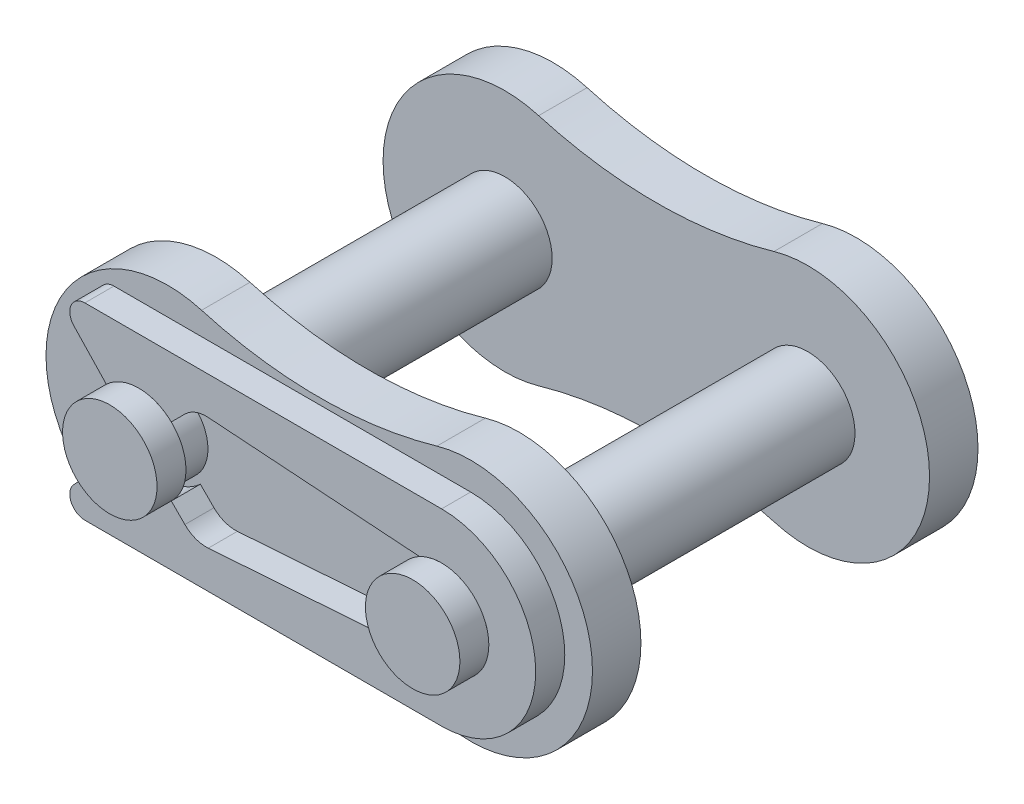
from build123d import *

# Parameters (mm, degrees)
SKETCH4_R                  = 3.9624
SKETCH4_R_2                = 2.0066
BOSS_EXTRUDE1_DEPTH        = 3.96875
SKETCH5_R                  = 1.9812
BOSS_EXTRUDE2_DEPTH        = 2.032
LPATTERN1_COUNT            = 2
LPATTERN1_PITCH            = 12.7
SKETCH7_R                  = 1.9812
BOSS_EXTRUDE3_DEPTH        = 2.032
MIRROR1_START              = 6.05155
MIRROR1_OUTLINE_R          = 1.9812
MIRROR1_DEPTH              = 2.032
BOSS_EXTRUDE4_DEPTH        = 10.5156
BOSS_EXTRUDE4_DEPTH_BACK   = 9.2964
SKETCH8_R                  = 1.9812
BOSS_EXTRUDE4_2_DEPTH      = 10.5156
BOSS_EXTRUDE4_2_DEPTH_BACK = 9.2964
BOSS_EXTRUDE5_DEPTH        = 1.2192
SKETCH12_R                 = 1.9812
SKETCH12_R_2               = 1.68402
CUT_EXTRUDE1_DEPTH         = 1.2192


# Read off the part's stored shape, not the designer's step: Mirror1
with BuildPart() as part:
    # Sketch4 → Boss-Extrude1 (new, symmetric)
    with BuildSketch(Plane.XY):
        with Locations((6.35, 0)):
            Circle(SKETCH4_R)
        with Locations((6.35, 0)):
            Circle(SKETCH4_R_2, mode=Mode.SUBTRACT)
    extrude(amount=BOSS_EXTRUDE1_DEPTH, both=True)


with BuildPart() as body_2:
    # Sketch5 → Boss-Extrude2 (new body)
    with BuildSketch(Plane.XY.offset(3.96875)):
        with BuildLine():
            ThreePointArc((-4.787931893, 5.589740462), (-12.1539, 0), (-4.787931893, -5.589740462))
            ThreePointArc((-4.787931893, -5.589740462), (0, -4.933315), (4.787931893, -5.589740462))
            ThreePointArc((4.787931893, -5.589740462), (12.1539, 0), (4.787931893, 5.589740462))
            ThreePointArc((4.787931893, 5.589740462), (0, 4.933315), (-4.787931893, 5.589740462))
        make_face()
        with Locations((-6.35, 0)):
            Circle(SKETCH5_R, mode=Mode.SUBTRACT)
        with Locations((6.35, 0)):
            Circle(SKETCH5_R, mode=Mode.SUBTRACT)
    extrude(amount=BOSS_EXTRUDE2_DEPTH)


with BuildPart() as lpattern1_1:
    # LPattern1: pattern copy
    add(part.part.moved(Location(Vector(1, 0, 0) * (1 * LPATTERN1_PITCH))))


with BuildPart() as body_4:
    # Sketch7 → Boss-Extrude3 (new body)
    with BuildSketch(Plane.XY.offset(-6.05155)):
        with BuildLine():
            ThreePointArc((7.766432158, 4.907095024), (1.242568, 0), (7.766432158, -4.907095024))
            ThreePointArc((7.766432158, -4.907095024), (12.7, -4.209302295), (17.633567842, -4.907095024))
            ThreePointArc((17.633567842, -4.907095024), (24.157432, 0), (17.633567842, 4.907095024))
            ThreePointArc((17.633567842, 4.907095024), (12.7, 4.209302295), (7.766432158, 4.907095024))
        make_face()
        with Locations((6.35, 0)):
            Circle(SKETCH7_R, mode=Mode.SUBTRACT)
        with Locations((19.05, 0)):
            Circle(SKETCH7_R, mode=Mode.SUBTRACT)
    extrude(amount=-BOSS_EXTRUDE3_DEPTH)


with BuildPart() as body_5:
    # Mirror1 outline → Mirror1 (new body)
    with BuildSketch(Plane.XY.offset(MIRROR1_START)):
        with BuildLine():
            ThreePointArc((17.633567842, -4.907095024), (24.157432, 0), (17.633567842, 4.907095024))
            ThreePointArc((17.633567842, 4.907095024), (12.7, 4.209302295), (7.766432158, 4.907095024))
            ThreePointArc((7.766432158, 4.907095024), (1.242568, 0), (7.766432158, -4.907095024))
            ThreePointArc((7.766432158, -4.907095024), (12.7, -4.209302295), (17.633567842, -4.907095024))
        make_face()
        with Locations((6.35, 0)):
            Circle(MIRROR1_OUTLINE_R, mode=Mode.SUBTRACT)
        with Locations((19.05, 0)):
            Circle(MIRROR1_OUTLINE_R, mode=Mode.SUBTRACT)
    extrude(amount=MIRROR1_DEPTH)


with BuildPart() as body_3:
    # Sketch8 → Boss-Extrude4 (new, two sides: drawn at the far end of the back side and taken through both)
    with BuildSketch(Plane.XY.offset(-BOSS_EXTRUDE4_DEPTH_BACK)):
        with Locations((6.35, 0)):
            Circle(SKETCH8_R)
    extrude(amount=BOSS_EXTRUDE4_DEPTH + BOSS_EXTRUDE4_DEPTH_BACK)


with BuildPart() as body_4_2:
    # Sketch8 → Boss-Extrude4 2 (new, two sides: drawn at the far end of the back side and taken through both)
    with BuildSketch(Plane.XY.offset(-BOSS_EXTRUDE4_2_DEPTH_BACK)):
        with Locations((19.05, 0)):
            Circle(SKETCH8_R)
    extrude(amount=BOSS_EXTRUDE4_2_DEPTH + BOSS_EXTRUDE4_2_DEPTH_BACK)


with BuildPart() as body_5_2:
    # Sketch10 → Boss-Extrude5 (new body)
    with BuildSketch(Plane.XY.offset(8.08355)):
        with BuildLine():
            Line((19.05, -3.946652), (4.091050732, -3.946652))
            ThreePointArc((4.091050732, -3.946652), (3.511202451, -3.565299839), (3.631666978, -2.881822116))
            Line((3.631666978, -2.881822116), (5.194473642, -1.225023345))
            ThreePointArc((5.194473642, -1.225023345), (6.35, -1.68402), (7.505526358, -1.225023345))
            Line((7.505526358, -1.225023345), (8.285872934, -2.005369922))
            ThreePointArc((8.285872934, -2.005369922), (8.73664223, -2.295314476), (9.267062878, -2.37222181))
            Line((9.267062878, -2.37222181), (19.167471297, -1.679917812))
            ThreePointArc((19.167471297, -1.679917812), (20.73402, 0), (19.167471297, 1.679917812))
            Line((19.167471297, 1.679917812), (9.267062878, 2.37222181))
            ThreePointArc((9.267062878, 2.37222181), (8.73664223, 2.295314476), (8.285872934, 2.005369922))
            Line((8.285872934, 2.005369922), (7.505526358, 1.225023345))
            ThreePointArc((7.505526358, 1.225023345), (6.35, 1.68402), (5.194473642, 1.225023345))
            Line((5.194473642, 1.225023345), (3.631666978, 2.881822116))
            ThreePointArc((3.631666978, 2.881822116), (3.511202451, 3.565299839), (4.091050732, 3.946652))
            Line((4.091050732, 3.946652), (19.05, 3.946652))
            ThreePointArc((19.05, 3.946652), (22.996652, 0), (19.05, -3.946652))
        make_face()
    extrude(amount=BOSS_EXTRUDE5_DEPTH)


with BuildPart() as cut_extrude1_tool:
    # Sketch12 → Cut-Extrude1 (new body)
    # profile 1 of 2: a face of its own
    with BuildSketch(Plane.XY.offset(8.08355)):
        with Locations((6.35, 0)):
            Circle(SKETCH12_R)
        with Locations((6.35, 0)):
            Circle(SKETCH12_R_2, mode=Mode.SUBTRACT)
    # profile 2 of 2: a face of its own
    with BuildSketch(Plane.XY.offset(8.08355)):
        with Locations((19.05, 0)):
            Circle(SKETCH12_R)
        with Locations((19.05, 0)):
            Circle(SKETCH12_R_2, mode=Mode.SUBTRACT)
    extrude(amount=CUT_EXTRUDE1_DEPTH)


with BuildPart() as body_3_1:
    add(body_3.part)

    # Cut-Extrude1: cut by cut_extrude1_tool
    add(cut_extrude1_tool.part, mode=Mode.SUBTRACT)


with BuildPart() as body_4_2_1:
    add(body_4_2.part)

    # Cut-Extrude1: cut by cut_extrude1_tool
    add(cut_extrude1_tool.part, mode=Mode.SUBTRACT)


with BuildPart() as body_5_2_1:
    add(body_5_2.part)

    # Cut-Extrude1: cut by cut_extrude1_tool
    add(cut_extrude1_tool.part, mode=Mode.SUBTRACT)


with BuildPart() as body_4_1:
    add(body_4.part)

    # Combine3: union body 5, body 4 2, body 3
    add(body_5.part)
    add(body_4_2_1.part)
    add(body_3_1.part)


solid = Compound([body_5_2_1.part, body_4_1.part])
